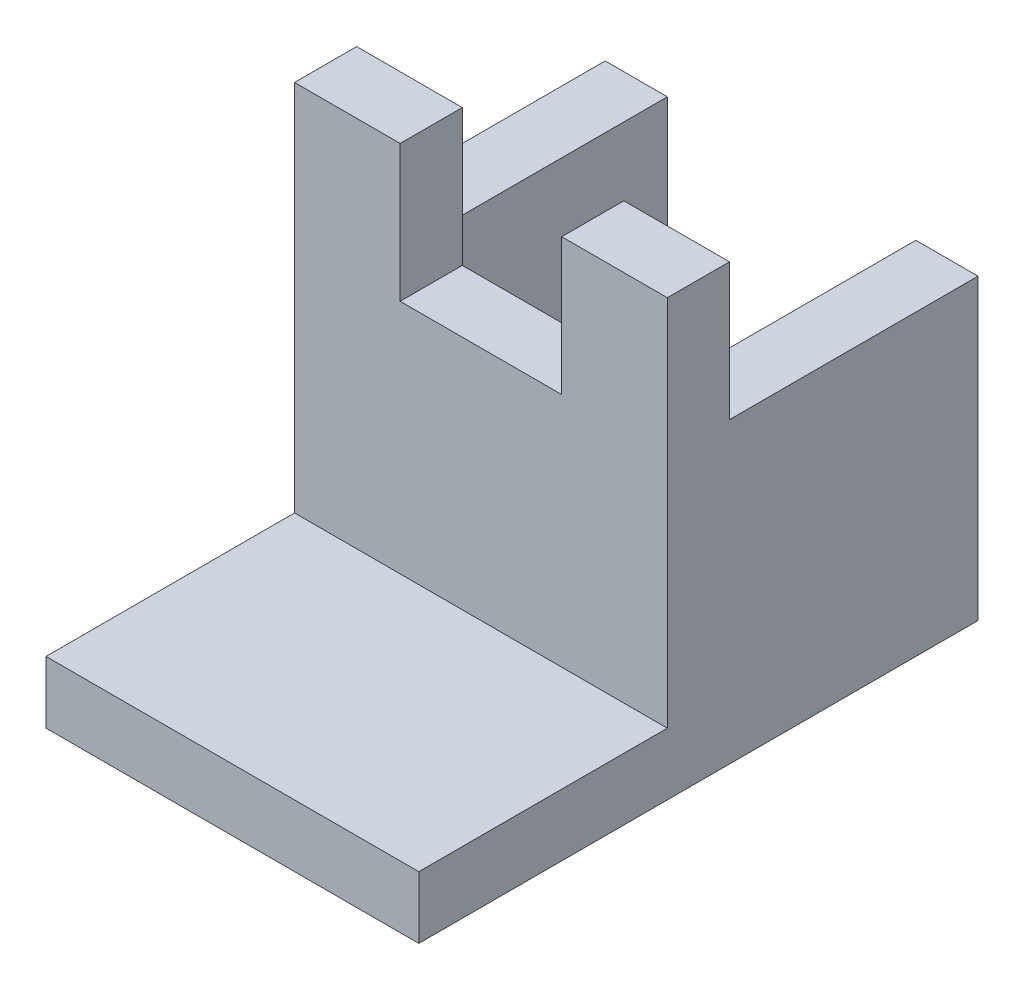
from build123d import *

# Parameters (mm, degrees)
SKETCH1_W           = 30
SKETCH1_H           = 45
BOSS_EXTRUDE1_DEPTH = 5
SKETCH2_W           = 30
SKETCH2_H           = 5
BOSS_EXTRUDE2_DEPTH = 30
SKETCH3_W           = 5
SKETCH3_H           = 20
BOSS_EXTRUDE3_DEPTH = 19
SKETCH4_W           = 13
SKETCH4_H           = 5
CUT_EXTRUDE1_DEPTH  = 11


with BuildPart() as part:
    # Sketch1 → Boss-Extrude1 (new body)
    with BuildSketch(Plane(origin=(0, 0, 0), x_dir=(1, 0, 0), z_dir=(0, 1, 0))):
        with Locations((15, 22.5)):
            Rectangle(SKETCH1_W, SKETCH1_H)
    extrude(amount=BOSS_EXTRUDE1_DEPTH)

    # Sketch2 → Boss-Extrude2 (add)
    with BuildSketch(Plane(origin=(0, 5, 0), x_dir=(1, 0, 0), z_dir=(0, 1, 0))):
        with Locations((15, 22.5)):
            Rectangle(SKETCH2_W, SKETCH2_H)
    extrude(amount=BOSS_EXTRUDE2_DEPTH)

    # Sketch3 → Boss-Extrude3 (add)
    with BuildSketch(Plane(origin=(0, 5, 0), x_dir=(1, 0, 0), z_dir=(0, 1, 0))):
        with Locations((2.5, 35)):
            Rectangle(SKETCH3_W, SKETCH3_H)
        with Locations((27.5, 35)):
            Rectangle(SKETCH3_W, SKETCH3_H)
    extrude(amount=BOSS_EXTRUDE3_DEPTH)

    # Sketch4 → Cut-Extrude1 (cut)
    with BuildSketch(Plane(origin=(0, 35, 0), x_dir=(1, 0, 0), z_dir=(0, 1, 0))):
        with Locations((15, 22.5)):
            Rectangle(SKETCH4_W, SKETCH4_H)
    extrude(amount=-CUT_EXTRUDE1_DEPTH, mode=Mode.SUBTRACT)


solid = part.part
